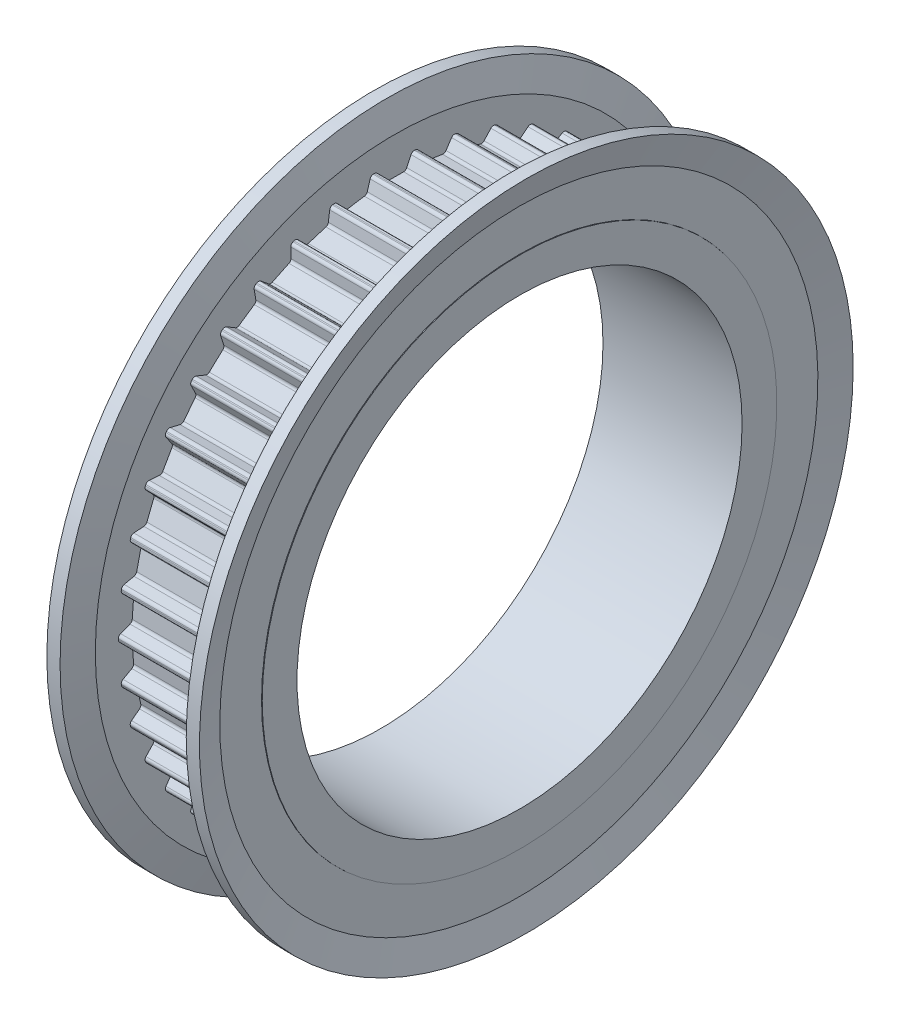
from build123d import *

# Parameters (mm, degrees)
REVOLVE1_START           = 0.05
REVOLVE1_DEPTH           = 9.9
REVOLVE1_START_2         = 9.535898285
REVOLVE1_2_OUTLINE_R     = 23.5
REVOLVE1_2_DEPTH         = 0.414101715
REVOLVE1_3_OUTLINE_R     = 23.5
REVOLVE1_3_DEPTH         = 0.414101515
REVOLVE1_4_OUTLINE_R     = 18.5
REVOLVE1_4_DEPTH         = 0.05
F_6_0_6_DIAMETER_HOLE1_D = 6
FILLET1_R                = 0.25
CUT_EXTRUDE1_DEPTH       = 35.849018135
CUT_EXTRUDE1_DEPTH_BACK  = 35.849018135
SKETCH5_R                = 16


with BuildPart() as part:
    # Revolve1: read off the stored shape, not the designer's step
    # Revolve1 outline → Revolve1 (new body)
    with BuildSketch(Plane.YZ.offset(REVOLVE1_START)):
        with BuildLine():
            ThreePointArc((-8.802769772, -17.791395233), (-8.612592221, -17.884232028), (-8.421435729, -17.975036029))
            Line((-8.421435729, -17.975036029), (-7.654649152, -17.245563817))
            Line((-7.654649152, -17.245563817), (-6.118707467, -17.848376507))
            Line((-6.118707467, -17.848376507), (-6.052780243, -18.904664803))
            ThreePointArc((-6.052780243, -18.904664803), (-5.850890212, -18.968120195), (-5.648335146, -19.029419594))
            Line((-5.648335146, -19.029419594), (-4.998835133, -18.193811374))
            Line((-4.998835133, -18.193811374), (-3.390204078, -18.560970915))
            Line((-3.390204078, -18.560970915), (-3.167581605, -19.595635401))
            ThreePointArc((-3.167581605, -19.595635401), (-2.958488984, -19.628291901), (-2.749060089, -19.65871737))
            Line((-2.749060089, -19.65871737), (-2.231355397, -18.73563925))
            Line((-2.231355397, -18.73563925), (-0.585969131, -18.858943904))
            Line((-0.585969131, -18.858943904), (-0.211624428, -19.848871885))
            ThreePointArc((-0.211624428, -19.848871885), (0, -19.85), (0.211624428, -19.848871885))
            Line((0.211624428, -19.848871885), (0.585969131, -18.858943904))
            Line((0.585969131, -18.858943904), (2.231355397, -18.73563925))
            Line((2.231355397, -18.73563925), (2.749060089, -19.65871737))
            ThreePointArc((2.749060089, -19.65871737), (2.958488984, -19.628291901), (3.167581605, -19.595635401))
            Line((3.167581605, -19.595635401), (3.390204078, -18.560970915))
            Line((3.390204078, -18.560970915), (4.998835133, -18.193811374))
            Line((4.998835133, -18.193811374), (5.648335146, -19.029419594))
            ThreePointArc((5.648335146, -19.029419594), (5.850890212, -18.968120195), (6.052780243, -18.904664803))
            Line((6.052780243, -18.904664803), (6.118707467, -17.848376507))
            Line((6.118707467, -17.848376507), (7.654649152, -17.245563817))
            Line((7.654649152, -17.245563817), (8.421435729, -17.975036029))
            ThreePointArc((8.421435729, -17.975036029), (8.612592221, -17.884232028), (8.802769772, -17.791395233))
            Line((8.802769772, -17.791395233), (8.710529042, -16.737078861))
            Line((8.710529042, -16.737078861), (10.139470958, -15.912078861))
            Line((10.139470958, -15.912078861), (11.006415354, -16.519119863))
            ThreePointArc((11.006415354, -16.519119863), (11.181903152, -16.40083967), (11.356119971, -16.280695293))
            Line((11.356119971, -16.280695293), (11.107771792, -15.251902531))
            Line((11.107771792, -15.251902531), (12.397793738, -14.223144358))
            Line((12.397793738, -14.223144358), (13.345529848, -14.694193856))
            ThreePointArc((13.345529848, -14.694193856), (13.501428845, -14.551079656), (13.655793215, -14.406311522))
            Line((13.655793215, -14.406311522), (13.256885275, -13.426023901))
            Line((13.256885275, -13.426023901), (14.379170293, -12.216488313))
            Line((14.379170293, -12.216488313), (15.386527258, -12.541023839))
            ThreePointArc((15.386527258, -12.541023839), (15.519354927, -12.376272567), (15.650418604, -12.210114558))
            Line((15.650418604, -12.210114558), (15.109861848, -11.300230083))
            Line((15.109861848, -11.300230083), (16.039339944, -9.936936106))
            Line((16.039339944, -9.936936106), (17.083815075, -10.107708073))
            ThreePointArc((17.083815075, -10.107708073), (17.190604265, -9.925), (17.295439503, -9.741163812))
            Line((17.295439503, -9.741163812), (16.625309075, -8.922007798))
            Line((16.625309075, -8.922007798), (17.341217245, -7.435409166))
            Line((17.341217245, -7.435409166), (18.399478692, -7.448602812))
            ThreePointArc((18.399478692, -7.448602812), (18.477843911, -7.252019334), (18.554108863, -7.054611562))
            Line((18.554108863, -7.054611562), (17.76937437, -6.344482602))
            Line((17.76937437, -6.344482602), (18.255720408, -4.767787473))
            Line((18.255720408, -4.767787473), (19.30412836, -4.623108072))
            ThreePointArc((19.30412836, -4.623108072), (19.352319057, -4.417040539), (19.398310091, -4.210470948))
            Line((19.398310091, -4.210470948), (18.516501205, -3.625232149))
            Line((18.516501205, -3.625232149), (18.762420944, -1.993661286))
            Line((18.762420944, -1.993661286), (19.7775557, -1.694340737))
            ThreePointArc((19.7775557, -1.694340737), (19.794495374, -1.483392358), (19.809185127, -1.27227537))
            Line((19.809185127, -1.27227537), (18.85, -0.825))
            Line((18.85, -0.825), (18.85, 0.825))
            Line((18.85, 0.825), (19.809185127, 1.27227537))
            ThreePointArc((19.809185127, 1.27227537), (19.794495374, 1.483392358), (19.7775557, 1.694340737))
            Line((19.7775557, 1.694340737), (18.762420944, 1.993661286))
            Line((18.762420944, 1.993661286), (18.516501205, 3.625232149))
            Line((18.516501205, 3.625232149), (19.398310091, 4.210470948))
            ThreePointArc((19.398310091, 4.210470948), (19.352319057, 4.417040539), (19.30412836, 4.623108072))
            Line((19.30412836, 4.623108072), (18.255720408, 4.767787473))
            Line((18.255720408, 4.767787473), (17.76937437, 6.344482602))
            Line((17.76937437, 6.344482602), (18.554108863, 7.054611562))
            ThreePointArc((18.554108863, 7.054611562), (18.477843911, 7.252019334), (18.399478692, 7.448602812))
            Line((18.399478692, 7.448602812), (17.341217245, 7.435409166))
            Line((17.341217245, 7.435409166), (16.625309075, 8.922007798))
            Line((16.625309075, 8.922007798), (17.295439503, 9.741163812))
            ThreePointArc((17.295439503, 9.741163812), (17.190604265, 9.925), (17.083815075, 10.107708073))
            Line((17.083815075, 10.107708073), (16.039339944, 9.936936106))
            Line((16.039339944, 9.936936106), (15.109861848, 11.300230083))
            Line((15.109861848, 11.300230083), (15.650418604, 12.210114558))
            ThreePointArc((15.650418604, 12.210114558), (15.519354927, 12.376272567), (15.386527258, 12.541023839))
            Line((15.386527258, 12.541023839), (14.379170293, 12.216488313))
            Line((14.379170293, 12.216488313), (13.256885275, 13.426023901))
            Line((13.256885275, 13.426023901), (13.655793215, 14.406311522))
            ThreePointArc((13.655793215, 14.406311522), (13.501428845, 14.551079656), (13.345529848, 14.694193856))
            Line((13.345529848, 14.694193856), (12.397793738, 14.223144358))
            Line((12.397793738, 14.223144358), (11.107771792, 15.251902531))
            Line((11.107771792, 15.251902531), (11.356119971, 16.280695293))
            ThreePointArc((11.356119971, 16.280695293), (11.181903152, 16.40083967), (11.006415354, 16.519119863))
            Line((11.006415354, 16.519119863), (10.139470958, 15.912078861))
            Line((10.139470958, 15.912078861), (8.710529042, 16.737078861))
            Line((8.710529042, 16.737078861), (8.802769772, 17.791395233))
            ThreePointArc((8.802769772, 17.791395233), (8.612592221, 17.884232028), (8.421435729, 17.975036029))
            Line((8.421435729, 17.975036029), (7.654649152, 17.245563817))
            Line((7.654649152, 17.245563817), (6.118707467, 17.848376507))
            Line((6.118707467, 17.848376507), (6.052780243, 18.904664803))
            ThreePointArc((6.052780243, 18.904664803), (5.850890212, 18.968120195), (5.648335146, 19.029419594))
            Line((5.648335146, 19.029419594), (4.998835133, 18.193811374))
            Line((4.998835133, 18.193811374), (3.390204078, 18.560970915))
            Line((3.390204078, 18.560970915), (3.167581605, 19.595635401))
            ThreePointArc((3.167581605, 19.595635401), (2.958488984, 19.628291901), (2.749060089, 19.65871737))
            Line((2.749060089, 19.65871737), (2.231355397, 18.73563925))
            Line((2.231355397, 18.73563925), (0.585969131, 18.858943904))
            Line((0.585969131, 18.858943904), (0.211624428, 19.848871885))
            ThreePointArc((0.211624428, 19.848871885), (0, 19.85), (-0.211624428, 19.848871885))
            Line((-0.211624428, 19.848871885), (-0.585969131, 18.858943904))
            Line((-0.585969131, 18.858943904), (-2.231355397, 18.73563925))
            Line((-2.231355397, 18.73563925), (-2.749060089, 19.65871737))
            ThreePointArc((-2.749060089, 19.65871737), (-2.958488984, 19.628291901), (-3.167581605, 19.595635401))
            Line((-3.167581605, 19.595635401), (-3.390204078, 18.560970915))
            Line((-3.390204078, 18.560970915), (-4.998835133, 18.193811374))
            Line((-4.998835133, 18.193811374), (-5.648335146, 19.029419594))
            ThreePointArc((-5.648335146, 19.029419594), (-5.850890212, 18.968120195), (-6.052780243, 18.904664803))
            Line((-6.052780243, 18.904664803), (-6.118707467, 17.848376507))
            Line((-6.118707467, 17.848376507), (-7.654649152, 17.245563817))
            Line((-7.654649152, 17.245563817), (-8.421435729, 17.975036029))
            ThreePointArc((-8.421435729, 17.975036029), (-8.612592221, 17.884232028), (-8.802769772, 17.791395233))
            Line((-8.802769772, 17.791395233), (-8.710529042, 16.737078861))
            Line((-8.710529042, 16.737078861), (-10.139470958, 15.912078861))
            Line((-10.139470958, 15.912078861), (-11.006415354, 16.519119863))
            ThreePointArc((-11.006415354, 16.519119863), (-11.181903152, 16.40083967), (-11.356119971, 16.280695293))
            Line((-11.356119971, 16.280695293), (-11.107771792, 15.251902531))
            Line((-11.107771792, 15.251902531), (-12.397793738, 14.223144358))
            Line((-12.397793738, 14.223144358), (-13.345529848, 14.694193856))
            ThreePointArc((-13.345529848, 14.694193856), (-13.501428845, 14.551079656), (-13.655793215, 14.406311522))
            Line((-13.655793215, 14.406311522), (-13.256885275, 13.426023901))
            Line((-13.256885275, 13.426023901), (-14.379170293, 12.216488313))
            Line((-14.379170293, 12.216488313), (-15.386527258, 12.541023839))
            ThreePointArc((-15.386527258, 12.541023839), (-15.519354927, 12.376272567), (-15.650418604, 12.210114558))
            Line((-15.650418604, 12.210114558), (-15.109861848, 11.300230083))
            Line((-15.109861848, 11.300230083), (-16.039339944, 9.936936106))
            Line((-16.039339944, 9.936936106), (-17.083815075, 10.107708073))
            ThreePointArc((-17.083815075, 10.107708073), (-17.190604265, 9.925), (-17.295439503, 9.741163812))
            Line((-17.295439503, 9.741163812), (-16.625309075, 8.922007798))
            Line((-16.625309075, 8.922007798), (-17.341217245, 7.435409166))
            Line((-17.341217245, 7.435409166), (-18.399478692, 7.448602812))
            ThreePointArc((-18.399478692, 7.448602812), (-18.477843911, 7.252019334), (-18.554108863, 7.054611562))
            Line((-18.554108863, 7.054611562), (-17.76937437, 6.344482602))
            Line((-17.76937437, 6.344482602), (-18.255720408, 4.767787473))
            Line((-18.255720408, 4.767787473), (-19.30412836, 4.623108072))
            ThreePointArc((-19.30412836, 4.623108072), (-19.352319057, 4.417040539), (-19.398310091, 4.210470948))
            Line((-19.398310091, 4.210470948), (-18.516501205, 3.625232149))
            Line((-18.516501205, 3.625232149), (-18.762420944, 1.993661286))
            Line((-18.762420944, 1.993661286), (-19.7775557, 1.694340737))
            ThreePointArc((-19.7775557, 1.694340737), (-19.794495374, 1.483392358), (-19.809185127, 1.27227537))
            Line((-19.809185127, 1.27227537), (-18.85, 0.825))
            Line((-18.85, 0.825), (-18.85, -0.825))
            Line((-18.85, -0.825), (-19.809185127, -1.27227537))
            ThreePointArc((-19.809185127, -1.27227537), (-19.794495374, -1.483392358), (-19.7775557, -1.694340737))
            Line((-19.7775557, -1.694340737), (-18.762420944, -1.993661286))
            Line((-18.762420944, -1.993661286), (-18.516501205, -3.625232149))
            Line((-18.516501205, -3.625232149), (-19.398310091, -4.210470948))
            ThreePointArc((-19.398310091, -4.210470948), (-19.352319057, -4.417040539), (-19.30412836, -4.623108072))
            Line((-19.30412836, -4.623108072), (-18.255720408, -4.767787473))
            Line((-18.255720408, -4.767787473), (-17.76937437, -6.344482602))
            Line((-17.76937437, -6.344482602), (-18.554108863, -7.054611562))
            ThreePointArc((-18.554108863, -7.054611562), (-18.477843911, -7.252019334), (-18.399478692, -7.448602812))
            Line((-18.399478692, -7.448602812), (-17.341217245, -7.435409166))
            Line((-17.341217245, -7.435409166), (-16.625309075, -8.922007798))
            Line((-16.625309075, -8.922007798), (-17.295439503, -9.741163812))
            ThreePointArc((-17.295439503, -9.741163812), (-17.190604265, -9.925), (-17.083815075, -10.107708073))
            Line((-17.083815075, -10.107708073), (-16.039339944, -9.936936106))
            Line((-16.039339944, -9.936936106), (-15.109861848, -11.300230083))
            Line((-15.109861848, -11.300230083), (-15.650418604, -12.210114558))
            ThreePointArc((-15.650418604, -12.210114558), (-15.519354927, -12.376272567), (-15.386527258, -12.541023839))
            Line((-15.386527258, -12.541023839), (-14.379170293, -12.216488313))
            Line((-14.379170293, -12.216488313), (-13.256885275, -13.426023901))
            Line((-13.256885275, -13.426023901), (-13.655793215, -14.406311522))
            ThreePointArc((-13.655793215, -14.406311522), (-13.501428845, -14.551079656), (-13.345529848, -14.694193856))
            Line((-13.345529848, -14.694193856), (-12.397793738, -14.223144358))
            Line((-12.397793738, -14.223144358), (-11.107771792, -15.251902531))
            Line((-11.107771792, -15.251902531), (-11.356119971, -16.280695293))
            ThreePointArc((-11.356119971, -16.280695293), (-11.181903152, -16.40083967), (-11.006415354, -16.519119863))
            Line((-11.006415354, -16.519119863), (-10.139470958, -15.912078861))
            Line((-10.139470958, -15.912078861), (-8.710529042, -16.737078861))
            Line((-8.710529042, -16.737078861), (-8.802769772, -17.791395233))
        make_face()
    extrude(amount=REVOLVE1_DEPTH)

    # Revolve1 2 outline → Revolve1 2 (add)
    with BuildSketch(Plane.YZ.offset(REVOLVE1_START_2)):
        Circle(REVOLVE1_2_OUTLINE_R)
        with BuildLine():
            Line((-7.654649152, -17.245563817), (-8.421435729, -17.975036029))
            ThreePointArc((-8.421435729, -17.975036029), (-8.612592221, -17.884232028), (-8.802769772, -17.791395233))
            Line((-8.802769772, -17.791395233), (-8.710529042, -16.737078861))
            Line((-8.710529042, -16.737078861), (-10.139470958, -15.912078861))
            Line((-10.139470958, -15.912078861), (-11.006415354, -16.519119863))
            ThreePointArc((-11.006415354, -16.519119863), (-11.181903152, -16.40083967), (-11.356119971, -16.280695293))
            Line((-11.356119971, -16.280695293), (-11.107771792, -15.251902531))
            Line((-11.107771792, -15.251902531), (-12.397793738, -14.223144358))
            Line((-12.397793738, -14.223144358), (-13.345529848, -14.694193856))
            ThreePointArc((-13.345529848, -14.694193856), (-13.501428845, -14.551079656), (-13.655793215, -14.406311522))
            Line((-13.655793215, -14.406311522), (-13.256885275, -13.426023901))
            Line((-13.256885275, -13.426023901), (-14.379170293, -12.216488313))
            Line((-14.379170293, -12.216488313), (-15.386527258, -12.541023839))
            ThreePointArc((-15.386527258, -12.541023839), (-15.519354927, -12.376272567), (-15.650418604, -12.210114558))
            Line((-15.650418604, -12.210114558), (-15.109861848, -11.300230083))
            Line((-15.109861848, -11.300230083), (-16.039339944, -9.936936106))
            Line((-16.039339944, -9.936936106), (-17.083815075, -10.107708073))
            ThreePointArc((-17.083815075, -10.107708073), (-17.190604265, -9.925), (-17.295439503, -9.741163812))
            Line((-17.295439503, -9.741163812), (-16.625309075, -8.922007798))
            Line((-16.625309075, -8.922007798), (-17.341217245, -7.435409166))
            Line((-17.341217245, -7.435409166), (-18.399478692, -7.448602812))
            ThreePointArc((-18.399478692, -7.448602812), (-18.477843911, -7.252019334), (-18.554108863, -7.054611562))
            Line((-18.554108863, -7.054611562), (-17.76937437, -6.344482602))
            Line((-17.76937437, -6.344482602), (-18.255720408, -4.767787473))
            Line((-18.255720408, -4.767787473), (-19.30412836, -4.623108072))
            ThreePointArc((-19.30412836, -4.623108072), (-19.352319057, -4.417040539), (-19.398310091, -4.210470948))
            Line((-19.398310091, -4.210470948), (-18.516501205, -3.625232149))
            Line((-18.516501205, -3.625232149), (-18.762420944, -1.993661286))
            Line((-18.762420944, -1.993661286), (-19.7775557, -1.694340737))
            ThreePointArc((-19.7775557, -1.694340737), (-19.794495374, -1.483392358), (-19.809185127, -1.27227537))
            Line((-19.809185127, -1.27227537), (-18.85, -0.825))
            Line((-18.85, -0.825), (-18.85, 0.825))
            Line((-18.85, 0.825), (-19.809185127, 1.27227537))
            ThreePointArc((-19.809185127, 1.27227537), (-19.794495374, 1.483392358), (-19.7775557, 1.694340737))
            Line((-19.7775557, 1.694340737), (-18.762420944, 1.993661286))
            Line((-18.762420944, 1.993661286), (-18.516501205, 3.625232149))
            Line((-18.516501205, 3.625232149), (-19.398310091, 4.210470948))
            ThreePointArc((-19.398310091, 4.210470948), (-19.352319057, 4.417040539), (-19.30412836, 4.623108072))
            Line((-19.30412836, 4.623108072), (-18.255720408, 4.767787473))
            Line((-18.255720408, 4.767787473), (-17.76937437, 6.344482602))
            Line((-17.76937437, 6.344482602), (-18.554108863, 7.054611562))
            ThreePointArc((-18.554108863, 7.054611562), (-18.477843911, 7.252019334), (-18.399478692, 7.448602812))
            Line((-18.399478692, 7.448602812), (-17.341217245, 7.435409166))
            Line((-17.341217245, 7.435409166), (-16.625309075, 8.922007798))
            Line((-16.625309075, 8.922007798), (-17.295439503, 9.741163812))
            ThreePointArc((-17.295439503, 9.741163812), (-17.190604265, 9.925), (-17.083815075, 10.107708073))
            Line((-17.083815075, 10.107708073), (-16.039339944, 9.936936106))
            Line((-16.039339944, 9.936936106), (-15.109861848, 11.300230083))
            Line((-15.109861848, 11.300230083), (-15.650418604, 12.210114558))
            ThreePointArc((-15.650418604, 12.210114558), (-15.519354927, 12.376272567), (-15.386527258, 12.541023839))
            Line((-15.386527258, 12.541023839), (-14.379170293, 12.216488313))
            Line((-14.379170293, 12.216488313), (-13.256885275, 13.426023901))
            Line((-13.256885275, 13.426023901), (-13.655793215, 14.406311522))
            ThreePointArc((-13.655793215, 14.406311522), (-13.501428845, 14.551079656), (-13.345529848, 14.694193856))
            Line((-13.345529848, 14.694193856), (-12.397793738, 14.223144358))
            Line((-12.397793738, 14.223144358), (-11.107771792, 15.251902531))
            Line((-11.107771792, 15.251902531), (-11.356119971, 16.280695293))
            ThreePointArc((-11.356119971, 16.280695293), (-11.181903152, 16.40083967), (-11.006415354, 16.519119863))
            Line((-11.006415354, 16.519119863), (-10.139470958, 15.912078861))
            Line((-10.139470958, 15.912078861), (-8.710529042, 16.737078861))
            Line((-8.710529042, 16.737078861), (-8.802769772, 17.791395233))
            ThreePointArc((-8.802769772, 17.791395233), (-8.612592221, 17.884232028), (-8.421435729, 17.975036029))
            Line((-8.421435729, 17.975036029), (-7.654649152, 17.245563817))
            Line((-7.654649152, 17.245563817), (-6.118707467, 17.848376507))
            Line((-6.118707467, 17.848376507), (-6.052780243, 18.904664803))
            ThreePointArc((-6.052780243, 18.904664803), (-5.850890212, 18.968120195), (-5.648335146, 19.029419594))
            Line((-5.648335146, 19.029419594), (-4.998835133, 18.193811374))
            Line((-4.998835133, 18.193811374), (-3.390204078, 18.560970915))
            Line((-3.390204078, 18.560970915), (-3.167581605, 19.595635401))
            ThreePointArc((-3.167581605, 19.595635401), (-2.958488984, 19.628291901), (-2.749060089, 19.65871737))
            Line((-2.749060089, 19.65871737), (-2.231355397, 18.73563925))
            Line((-2.231355397, 18.73563925), (-0.585969131, 18.858943904))
            Line((-0.585969131, 18.858943904), (-0.211624428, 19.848871885))
            ThreePointArc((-0.211624428, 19.848871885), (0, 19.85), (0.211624428, 19.848871885))
            Line((0.211624428, 19.848871885), (0.585969131, 18.858943904))
            Line((0.585969131, 18.858943904), (2.231355397, 18.73563925))
            Line((2.231355397, 18.73563925), (2.749060089, 19.65871737))
            ThreePointArc((2.749060089, 19.65871737), (2.958488984, 19.628291901), (3.167581605, 19.595635401))
            Line((3.167581605, 19.595635401), (3.390204078, 18.560970915))
            Line((3.390204078, 18.560970915), (4.998835133, 18.193811374))
            Line((4.998835133, 18.193811374), (5.648335146, 19.029419594))
            ThreePointArc((5.648335146, 19.029419594), (5.850890212, 18.968120195), (6.052780243, 18.904664803))
            Line((6.052780243, 18.904664803), (6.118707467, 17.848376507))
            Line((6.118707467, 17.848376507), (7.654649152, 17.245563817))
            Line((7.654649152, 17.245563817), (8.421435729, 17.975036029))
            ThreePointArc((8.421435729, 17.975036029), (8.612592221, 17.884232028), (8.802769772, 17.791395233))
            Line((8.802769772, 17.791395233), (8.710529042, 16.737078861))
            Line((8.710529042, 16.737078861), (10.139470958, 15.912078861))
            Line((10.139470958, 15.912078861), (11.006415354, 16.519119863))
            ThreePointArc((11.006415354, 16.519119863), (11.181903152, 16.40083967), (11.356119971, 16.280695293))
            Line((11.356119971, 16.280695293), (11.107771792, 15.251902531))
            Line((11.107771792, 15.251902531), (12.397793738, 14.223144358))
            Line((12.397793738, 14.223144358), (13.345529848, 14.694193856))
            ThreePointArc((13.345529848, 14.694193856), (13.501428845, 14.551079656), (13.655793215, 14.406311522))
            Line((13.655793215, 14.406311522), (13.256885275, 13.426023901))
            Line((13.256885275, 13.426023901), (14.379170293, 12.216488313))
            Line((14.379170293, 12.216488313), (15.386527258, 12.541023839))
            ThreePointArc((15.386527258, 12.541023839), (15.519354927, 12.376272567), (15.650418604, 12.210114558))
            Line((15.650418604, 12.210114558), (15.109861848, 11.300230083))
            Line((15.109861848, 11.300230083), (16.039339944, 9.936936106))
            Line((16.039339944, 9.936936106), (17.083815075, 10.107708073))
            ThreePointArc((17.083815075, 10.107708073), (17.190604265, 9.925), (17.295439503, 9.741163812))
            Line((17.295439503, 9.741163812), (16.625309075, 8.922007798))
            Line((16.625309075, 8.922007798), (17.341217245, 7.435409166))
            Line((17.341217245, 7.435409166), (18.399478692, 7.448602812))
            ThreePointArc((18.399478692, 7.448602812), (18.477843911, 7.252019334), (18.554108863, 7.054611562))
            Line((18.554108863, 7.054611562), (17.76937437, 6.344482602))
            Line((17.76937437, 6.344482602), (18.255720408, 4.767787473))
            Line((18.255720408, 4.767787473), (19.30412836, 4.623108072))
            ThreePointArc((19.30412836, 4.623108072), (19.352319057, 4.417040539), (19.398310091, 4.210470948))
            Line((19.398310091, 4.210470948), (18.516501205, 3.625232149))
            Line((18.516501205, 3.625232149), (18.762420944, 1.993661286))
            Line((18.762420944, 1.993661286), (19.7775557, 1.694340737))
            ThreePointArc((19.7775557, 1.694340737), (19.794495374, 1.483392358), (19.809185127, 1.27227537))
            Line((19.809185127, 1.27227537), (18.85, 0.825))
            Line((18.85, 0.825), (18.85, -0.825))
            Line((18.85, -0.825), (19.809185127, -1.27227537))
            ThreePointArc((19.809185127, -1.27227537), (19.794495374, -1.483392358), (19.7775557, -1.694340737))
            Line((19.7775557, -1.694340737), (18.762420944, -1.993661286))
            Line((18.762420944, -1.993661286), (18.516501205, -3.625232149))
            Line((18.516501205, -3.625232149), (19.398310091, -4.210470948))
            ThreePointArc((19.398310091, -4.210470948), (19.352319057, -4.417040539), (19.30412836, -4.623108072))
            Line((19.30412836, -4.623108072), (18.255720408, -4.767787473))
            Line((18.255720408, -4.767787473), (17.76937437, -6.344482602))
            Line((17.76937437, -6.344482602), (18.554108863, -7.054611562))
            ThreePointArc((18.554108863, -7.054611562), (18.477843911, -7.252019334), (18.399478692, -7.448602812))
            Line((18.399478692, -7.448602812), (17.341217245, -7.435409166))
            Line((17.341217245, -7.435409166), (16.625309075, -8.922007798))
            Line((16.625309075, -8.922007798), (17.295439503, -9.741163812))
            ThreePointArc((17.295439503, -9.741163812), (17.190604265, -9.925), (17.083815075, -10.107708073))
            Line((17.083815075, -10.107708073), (16.039339944, -9.936936106))
            Line((16.039339944, -9.936936106), (15.109861848, -11.300230083))
            Line((15.109861848, -11.300230083), (15.650418604, -12.210114558))
            ThreePointArc((15.650418604, -12.210114558), (15.519354927, -12.376272567), (15.386527258, -12.541023839))
            Line((15.386527258, -12.541023839), (14.379170293, -12.216488313))
            Line((14.379170293, -12.216488313), (13.256885275, -13.426023901))
            Line((13.256885275, -13.426023901), (13.655793215, -14.406311522))
            ThreePointArc((13.655793215, -14.406311522), (13.501428845, -14.551079656), (13.345529848, -14.694193856))
            Line((13.345529848, -14.694193856), (12.397793738, -14.223144358))
            Line((12.397793738, -14.223144358), (11.107771792, -15.251902531))
            Line((11.107771792, -15.251902531), (11.356119971, -16.280695293))
            ThreePointArc((11.356119971, -16.280695293), (11.181903152, -16.40083967), (11.006415354, -16.519119863))
            Line((11.006415354, -16.519119863), (10.139470958, -15.912078861))
            Line((10.139470958, -15.912078861), (8.710529042, -16.737078861))
            Line((8.710529042, -16.737078861), (8.802769772, -17.791395233))
            ThreePointArc((8.802769772, -17.791395233), (8.612592221, -17.884232028), (8.421435729, -17.975036029))
            Line((8.421435729, -17.975036029), (7.654649152, -17.245563817))
            Line((7.654649152, -17.245563817), (6.118707467, -17.848376507))
            Line((6.118707467, -17.848376507), (6.052780243, -18.904664803))
            ThreePointArc((6.052780243, -18.904664803), (5.850890212, -18.968120195), (5.648335146, -19.029419594))
            Line((5.648335146, -19.029419594), (4.998835133, -18.193811374))
            Line((4.998835133, -18.193811374), (3.390204078, -18.560970915))
            Line((3.390204078, -18.560970915), (3.167581605, -19.595635401))
            ThreePointArc((3.167581605, -19.595635401), (2.958488984, -19.628291901), (2.749060089, -19.65871737))
            Line((2.749060089, -19.65871737), (2.231355397, -18.73563925))
            Line((2.231355397, -18.73563925), (0.585969131, -18.858943904))
            Line((0.585969131, -18.858943904), (0.211624428, -19.848871885))
            ThreePointArc((0.211624428, -19.848871885), (0, -19.85), (-0.211624428, -19.848871885))
            Line((-0.211624428, -19.848871885), (-0.585969131, -18.858943904))
            Line((-0.585969131, -18.858943904), (-2.231355397, -18.73563925))
            Line((-2.231355397, -18.73563925), (-2.749060089, -19.65871737))
            ThreePointArc((-2.749060089, -19.65871737), (-2.958488984, -19.628291901), (-3.167581605, -19.595635401))
            Line((-3.167581605, -19.595635401), (-3.390204078, -18.560970915))
            Line((-3.390204078, -18.560970915), (-4.998835133, -18.193811374))
            Line((-4.998835133, -18.193811374), (-5.648335146, -19.029419594))
            ThreePointArc((-5.648335146, -19.029419594), (-5.850890212, -18.968120195), (-6.052780243, -18.904664803))
            Line((-6.052780243, -18.904664803), (-6.118707467, -17.848376507))
            Line((-6.118707467, -17.848376507), (-7.654649152, -17.245563817))
        make_face(mode=Mode.SUBTRACT)
    extrude(amount=REVOLVE1_2_DEPTH)

    # Revolve1 3 outline → Revolve1 3 (add)
    with BuildSketch(Plane.YZ.offset(REVOLVE1_START)):
        Circle(REVOLVE1_3_OUTLINE_R)
        with BuildLine():
            Line((-7.654649152, -17.245563817), (-8.421435729, -17.975036029))
            ThreePointArc((-8.421435729, -17.975036029), (-8.612592221, -17.884232028), (-8.802769772, -17.791395233))
            Line((-8.802769772, -17.791395233), (-8.710529042, -16.737078861))
            Line((-8.710529042, -16.737078861), (-10.139470958, -15.912078861))
            Line((-10.139470958, -15.912078861), (-11.006415354, -16.519119863))
            ThreePointArc((-11.006415354, -16.519119863), (-11.181903152, -16.40083967), (-11.356119971, -16.280695293))
            Line((-11.356119971, -16.280695293), (-11.107771792, -15.251902531))
            Line((-11.107771792, -15.251902531), (-12.397793738, -14.223144358))
            Line((-12.397793738, -14.223144358), (-13.345529848, -14.694193856))
            ThreePointArc((-13.345529848, -14.694193856), (-13.501428845, -14.551079656), (-13.655793215, -14.406311522))
            Line((-13.655793215, -14.406311522), (-13.256885275, -13.426023901))
            Line((-13.256885275, -13.426023901), (-14.379170293, -12.216488313))
            Line((-14.379170293, -12.216488313), (-15.386527258, -12.541023839))
            ThreePointArc((-15.386527258, -12.541023839), (-15.519354927, -12.376272567), (-15.650418604, -12.210114558))
            Line((-15.650418604, -12.210114558), (-15.109861848, -11.300230083))
            Line((-15.109861848, -11.300230083), (-16.039339944, -9.936936106))
            Line((-16.039339944, -9.936936106), (-17.083815075, -10.107708073))
            ThreePointArc((-17.083815075, -10.107708073), (-17.190604265, -9.925), (-17.295439503, -9.741163812))
            Line((-17.295439503, -9.741163812), (-16.625309075, -8.922007798))
            Line((-16.625309075, -8.922007798), (-17.341217245, -7.435409166))
            Line((-17.341217245, -7.435409166), (-18.399478692, -7.448602812))
            ThreePointArc((-18.399478692, -7.448602812), (-18.477843911, -7.252019334), (-18.554108863, -7.054611562))
            Line((-18.554108863, -7.054611562), (-17.76937437, -6.344482602))
            Line((-17.76937437, -6.344482602), (-18.255720408, -4.767787473))
            Line((-18.255720408, -4.767787473), (-19.30412836, -4.623108072))
            ThreePointArc((-19.30412836, -4.623108072), (-19.352319057, -4.417040539), (-19.398310091, -4.210470948))
            Line((-19.398310091, -4.210470948), (-18.516501205, -3.625232149))
            Line((-18.516501205, -3.625232149), (-18.762420944, -1.993661286))
            Line((-18.762420944, -1.993661286), (-19.7775557, -1.694340737))
            ThreePointArc((-19.7775557, -1.694340737), (-19.794495374, -1.483392358), (-19.809185127, -1.27227537))
            Line((-19.809185127, -1.27227537), (-18.85, -0.825))
            Line((-18.85, -0.825), (-18.85, 0.825))
            Line((-18.85, 0.825), (-19.809185127, 1.27227537))
            ThreePointArc((-19.809185127, 1.27227537), (-19.794495374, 1.483392358), (-19.7775557, 1.694340737))
            Line((-19.7775557, 1.694340737), (-18.762420944, 1.993661286))
            Line((-18.762420944, 1.993661286), (-18.516501205, 3.625232149))
            Line((-18.516501205, 3.625232149), (-19.398310091, 4.210470948))
            ThreePointArc((-19.398310091, 4.210470948), (-19.352319057, 4.417040539), (-19.30412836, 4.623108072))
            Line((-19.30412836, 4.623108072), (-18.255720408, 4.767787473))
            Line((-18.255720408, 4.767787473), (-17.76937437, 6.344482602))
            Line((-17.76937437, 6.344482602), (-18.554108863, 7.054611562))
            ThreePointArc((-18.554108863, 7.054611562), (-18.477843911, 7.252019334), (-18.399478692, 7.448602812))
            Line((-18.399478692, 7.448602812), (-17.341217245, 7.435409166))
            Line((-17.341217245, 7.435409166), (-16.625309075, 8.922007798))
            Line((-16.625309075, 8.922007798), (-17.295439503, 9.741163812))
            ThreePointArc((-17.295439503, 9.741163812), (-17.190604265, 9.925), (-17.083815075, 10.107708073))
            Line((-17.083815075, 10.107708073), (-16.039339944, 9.936936106))
            Line((-16.039339944, 9.936936106), (-15.109861848, 11.300230083))
            Line((-15.109861848, 11.300230083), (-15.650418604, 12.210114558))
            ThreePointArc((-15.650418604, 12.210114558), (-15.519354927, 12.376272567), (-15.386527258, 12.541023839))
            Line((-15.386527258, 12.541023839), (-14.379170293, 12.216488313))
            Line((-14.379170293, 12.216488313), (-13.256885275, 13.426023901))
            Line((-13.256885275, 13.426023901), (-13.655793215, 14.406311522))
            ThreePointArc((-13.655793215, 14.406311522), (-13.501428845, 14.551079656), (-13.345529848, 14.694193856))
            Line((-13.345529848, 14.694193856), (-12.397793738, 14.223144358))
            Line((-12.397793738, 14.223144358), (-11.107771792, 15.251902531))
            Line((-11.107771792, 15.251902531), (-11.356119971, 16.280695293))
            ThreePointArc((-11.356119971, 16.280695293), (-11.181903152, 16.40083967), (-11.006415354, 16.519119863))
            Line((-11.006415354, 16.519119863), (-10.139470958, 15.912078861))
            Line((-10.139470958, 15.912078861), (-8.710529042, 16.737078861))
            Line((-8.710529042, 16.737078861), (-8.802769772, 17.791395233))
            ThreePointArc((-8.802769772, 17.791395233), (-8.612592221, 17.884232028), (-8.421435729, 17.975036029))
            Line((-8.421435729, 17.975036029), (-7.654649152, 17.245563817))
            Line((-7.654649152, 17.245563817), (-6.118707467, 17.848376507))
            Line((-6.118707467, 17.848376507), (-6.052780243, 18.904664803))
            ThreePointArc((-6.052780243, 18.904664803), (-5.850890212, 18.968120195), (-5.648335146, 19.029419594))
            Line((-5.648335146, 19.029419594), (-4.998835133, 18.193811374))
            Line((-4.998835133, 18.193811374), (-3.390204078, 18.560970915))
            Line((-3.390204078, 18.560970915), (-3.167581605, 19.595635401))
            ThreePointArc((-3.167581605, 19.595635401), (-2.958488984, 19.628291901), (-2.749060089, 19.65871737))
            Line((-2.749060089, 19.65871737), (-2.231355397, 18.73563925))
            Line((-2.231355397, 18.73563925), (-0.585969131, 18.858943904))
            Line((-0.585969131, 18.858943904), (-0.211624428, 19.848871885))
            ThreePointArc((-0.211624428, 19.848871885), (0, 19.85), (0.211624428, 19.848871885))
            Line((0.211624428, 19.848871885), (0.585969131, 18.858943904))
            Line((0.585969131, 18.858943904), (2.231355397, 18.73563925))
            Line((2.231355397, 18.73563925), (2.749060089, 19.65871737))
            ThreePointArc((2.749060089, 19.65871737), (2.958488984, 19.628291901), (3.167581605, 19.595635401))
            Line((3.167581605, 19.595635401), (3.390204078, 18.560970915))
            Line((3.390204078, 18.560970915), (4.998835133, 18.193811374))
            Line((4.998835133, 18.193811374), (5.648335146, 19.029419594))
            ThreePointArc((5.648335146, 19.029419594), (5.850890212, 18.968120195), (6.052780243, 18.904664803))
            Line((6.052780243, 18.904664803), (6.118707467, 17.848376507))
            Line((6.118707467, 17.848376507), (7.654649152, 17.245563817))
            Line((7.654649152, 17.245563817), (8.421435729, 17.975036029))
            ThreePointArc((8.421435729, 17.975036029), (8.612592221, 17.884232028), (8.802769772, 17.791395233))
            Line((8.802769772, 17.791395233), (8.710529042, 16.737078861))
            Line((8.710529042, 16.737078861), (10.139470958, 15.912078861))
            Line((10.139470958, 15.912078861), (11.006415354, 16.519119863))
            ThreePointArc((11.006415354, 16.519119863), (11.181903152, 16.40083967), (11.356119971, 16.280695293))
            Line((11.356119971, 16.280695293), (11.107771792, 15.251902531))
            Line((11.107771792, 15.251902531), (12.397793738, 14.223144358))
            Line((12.397793738, 14.223144358), (13.345529848, 14.694193856))
            ThreePointArc((13.345529848, 14.694193856), (13.501428845, 14.551079656), (13.655793215, 14.406311522))
            Line((13.655793215, 14.406311522), (13.256885275, 13.426023901))
            Line((13.256885275, 13.426023901), (14.379170293, 12.216488313))
            Line((14.379170293, 12.216488313), (15.386527258, 12.541023839))
            ThreePointArc((15.386527258, 12.541023839), (15.519354927, 12.376272567), (15.650418604, 12.210114558))
            Line((15.650418604, 12.210114558), (15.109861848, 11.300230083))
            Line((15.109861848, 11.300230083), (16.039339944, 9.936936106))
            Line((16.039339944, 9.936936106), (17.083815075, 10.107708073))
            ThreePointArc((17.083815075, 10.107708073), (17.190604265, 9.925), (17.295439503, 9.741163812))
            Line((17.295439503, 9.741163812), (16.625309075, 8.922007798))
            Line((16.625309075, 8.922007798), (17.341217245, 7.435409166))
            Line((17.341217245, 7.435409166), (18.399478692, 7.448602812))
            ThreePointArc((18.399478692, 7.448602812), (18.477843911, 7.252019334), (18.554108863, 7.054611562))
            Line((18.554108863, 7.054611562), (17.76937437, 6.344482602))
            Line((17.76937437, 6.344482602), (18.255720408, 4.767787473))
            Line((18.255720408, 4.767787473), (19.30412836, 4.623108072))
            ThreePointArc((19.30412836, 4.623108072), (19.352319057, 4.417040539), (19.398310091, 4.210470948))
            Line((19.398310091, 4.210470948), (18.516501205, 3.625232149))
            Line((18.516501205, 3.625232149), (18.762420944, 1.993661286))
            Line((18.762420944, 1.993661286), (19.7775557, 1.694340737))
            ThreePointArc((19.7775557, 1.694340737), (19.794495374, 1.483392358), (19.809185127, 1.27227537))
            Line((19.809185127, 1.27227537), (18.85, 0.825))
            Line((18.85, 0.825), (18.85, -0.825))
            Line((18.85, -0.825), (19.809185127, -1.27227537))
            ThreePointArc((19.809185127, -1.27227537), (19.794495374, -1.483392358), (19.7775557, -1.694340737))
            Line((19.7775557, -1.694340737), (18.762420944, -1.993661286))
            Line((18.762420944, -1.993661286), (18.516501205, -3.625232149))
            Line((18.516501205, -3.625232149), (19.398310091, -4.210470948))
            ThreePointArc((19.398310091, -4.210470948), (19.352319057, -4.417040539), (19.30412836, -4.623108072))
            Line((19.30412836, -4.623108072), (18.255720408, -4.767787473))
            Line((18.255720408, -4.767787473), (17.76937437, -6.344482602))
            Line((17.76937437, -6.344482602), (18.554108863, -7.054611562))
            ThreePointArc((18.554108863, -7.054611562), (18.477843911, -7.252019334), (18.399478692, -7.448602812))
            Line((18.399478692, -7.448602812), (17.341217245, -7.435409166))
            Line((17.341217245, -7.435409166), (16.625309075, -8.922007798))
            Line((16.625309075, -8.922007798), (17.295439503, -9.741163812))
            ThreePointArc((17.295439503, -9.741163812), (17.190604265, -9.925), (17.083815075, -10.107708073))
            Line((17.083815075, -10.107708073), (16.039339944, -9.936936106))
            Line((16.039339944, -9.936936106), (15.109861848, -11.300230083))
            Line((15.109861848, -11.300230083), (15.650418604, -12.210114558))
            ThreePointArc((15.650418604, -12.210114558), (15.519354927, -12.376272567), (15.386527258, -12.541023839))
            Line((15.386527258, -12.541023839), (14.379170293, -12.216488313))
            Line((14.379170293, -12.216488313), (13.256885275, -13.426023901))
            Line((13.256885275, -13.426023901), (13.655793215, -14.406311522))
            ThreePointArc((13.655793215, -14.406311522), (13.501428845, -14.551079656), (13.345529848, -14.694193856))
            Line((13.345529848, -14.694193856), (12.397793738, -14.223144358))
            Line((12.397793738, -14.223144358), (11.107771792, -15.251902531))
            Line((11.107771792, -15.251902531), (11.356119971, -16.280695293))
            ThreePointArc((11.356119971, -16.280695293), (11.181903152, -16.40083967), (11.006415354, -16.519119863))
            Line((11.006415354, -16.519119863), (10.139470958, -15.912078861))
            Line((10.139470958, -15.912078861), (8.710529042, -16.737078861))
            Line((8.710529042, -16.737078861), (8.802769772, -17.791395233))
            ThreePointArc((8.802769772, -17.791395233), (8.612592221, -17.884232028), (8.421435729, -17.975036029))
            Line((8.421435729, -17.975036029), (7.654649152, -17.245563817))
            Line((7.654649152, -17.245563817), (6.118707467, -17.848376507))
            Line((6.118707467, -17.848376507), (6.052780243, -18.904664803))
            ThreePointArc((6.052780243, -18.904664803), (5.850890212, -18.968120195), (5.648335146, -19.029419594))
            Line((5.648335146, -19.029419594), (4.998835133, -18.193811374))
            Line((4.998835133, -18.193811374), (3.390204078, -18.560970915))
            Line((3.390204078, -18.560970915), (3.167581605, -19.595635401))
            ThreePointArc((3.167581605, -19.595635401), (2.958488984, -19.628291901), (2.749060089, -19.65871737))
            Line((2.749060089, -19.65871737), (2.231355397, -18.73563925))
            Line((2.231355397, -18.73563925), (0.585969131, -18.858943904))
            Line((0.585969131, -18.858943904), (0.211624428, -19.848871885))
            ThreePointArc((0.211624428, -19.848871885), (0, -19.85), (-0.211624428, -19.848871885))
            Line((-0.211624428, -19.848871885), (-0.585969131, -18.858943904))
            Line((-0.585969131, -18.858943904), (-2.231355397, -18.73563925))
            Line((-2.231355397, -18.73563925), (-2.749060089, -19.65871737))
            ThreePointArc((-2.749060089, -19.65871737), (-2.958488984, -19.628291901), (-3.167581605, -19.595635401))
            Line((-3.167581605, -19.595635401), (-3.390204078, -18.560970915))
            Line((-3.390204078, -18.560970915), (-4.998835133, -18.193811374))
            Line((-4.998835133, -18.193811374), (-5.648335146, -19.029419594))
            ThreePointArc((-5.648335146, -19.029419594), (-5.850890212, -18.968120195), (-6.052780243, -18.904664803))
            Line((-6.052780243, -18.904664803), (-6.118707467, -17.848376507))
            Line((-6.118707467, -17.848376507), (-7.654649152, -17.245563817))
        make_face(mode=Mode.SUBTRACT)
    extrude(amount=REVOLVE1_3_DEPTH)

    # Revolve1 4 outline → Revolve1 4 (add)
    with BuildSketch(Plane.YZ):
        Circle(REVOLVE1_4_OUTLINE_R)
    extrude(amount=REVOLVE1_4_DEPTH)

    # Revolve1 5 outline → Revolve1 5 (revolve)
    with BuildSketch(Plane.YX):
        Polygon((23.5, 9.535898345), (18.85, 9.535898285), (18.85, 9), (21.5, 9), align=None)
        Polygon((18.85, 0.464101515), (23.5, 0.464101575), (21.5, 1), (18.85, 1), align=None)
        Polygon((21.5, 9.95), (23.5, 9.95), (23.5, 10.485898385), align=None)
        Polygon((23.5, -0.485898385), (23.5, 0.05), (21.5, 0.05), align=None)
    revolve(axis=Axis((0, 0, 0), (1, 0, 0)))

    # Sketch2 → Revolve2 (revolve)
    with BuildSketch(Plane(origin=(0, 0, 0), x_dir=(-1, 0, 0), z_dir=(0, 0, -1)), mode=Mode.PRIVATE) as revolve2_sk:
        Polygon((-16, 13), (-16, 0), (-9.95, 0), (-9.95, 18.5), (-10, 18.5), (-10, 13), align=None)
    revolve(revolve2_sk.sketch.rotate(Axis((16, 0, 0), (-1, 0, 0)), 270), axis=Axis((16, 0, 0), (-1, 0, 0)))

    # Ø6.0 (6) Diameter Hole1 (through all)
    with Locations(Plane(origin=(16, 0, 0), x_dir=(0, 0, -1), z_dir=(1, 0, 0))):
        with Locations((0, 0)):
            Hole(F_6_0_6_DIAMETER_HOLE1_D / 2)

    # Fillet1
    fillet1_edges = [part.edges().sort_by_distance(p)[0] for p in [
        (5, -0.211624428, -19.848871885),
        (5, 19.30412836, -4.623108072),
        (5, -14.379170293, -12.216488313),
        (5, 18.516501205, -3.625232149),
        (5, 0.211624428, -19.848871885),
        (5, 19.7775557, -1.694340737),
        (5, -15.386527258, -12.541023839),
        (5, 18.85, -0.825),
        (5, 0.585969131, -18.858943904),
        (5, 19.809185127, 1.27227537),
        (5, -15.650418604, -12.210114558),
        (5, 18.762420944, 1.993661286),
        (5, 2.231355397, -18.73563925),
        (5, 19.398310091, 4.210470948),
        (5, -15.109861848, -11.300230083),
        (5, 18.255720408, 4.767787473),
        (5, 2.749060089, -19.65871737),
        (5, 18.554108863, 7.054611562),
        (5, -16.039339944, -9.936936106),
        (5, 17.341217245, 7.435409166),
        (5, 3.167581605, -19.595635401),
        (5, 17.295439503, 9.741163812),
        (5, -17.083815075, -10.107708073),
        (5, 16.039339944, 9.936936106),
        (5, 3.390204078, -18.560970915),
        (5, 15.650418604, 12.210114558),
        (5, -17.295439503, -9.741163812),
        (5, 14.379170293, 12.216488313),
        (5, 4.998835133, -18.193811374),
        (5, 13.655793215, 14.406311522),
        (5, -16.625309075, -8.922007798),
        (5, 12.397793738, 14.223144358),
        (5, 5.648335146, -19.029419594),
        (5, 11.356119971, 16.280695293),
        (5, -17.341217245, -7.435409166),
        (5, 10.139470958, 15.912078861),
        (5, 6.052780243, -18.904664803),
        (5, 8.802769772, 17.791395233),
        (5, -18.399478692, -7.448602812),
        (5, -17.341217245, 7.435409166),
        (5, 6.118707467, -17.848376507),
        (5, -16.625309075, 8.922007798),
        (5, -18.554108863, -7.054611562),
        (5, -17.295439503, 9.741163812),
        (5, 7.654649152, -17.245563817),
        (5, -17.083815075, 10.107708073),
        (5, -17.76937437, -6.344482602),
        (5, -16.039339944, 9.936936106),
        (5, 8.421435729, -17.975036029),
        (5, -15.109861848, 11.300230083),
        (5, -18.255720408, -4.767787473),
        (5, -15.650418604, 12.210114558),
        (5, 8.802769772, -17.791395233),
        (5, -15.386527258, 12.541023839),
        (5, -19.30412836, -4.623108072),
        (5, -14.379170293, 12.216488313),
        (5, 8.710529042, -16.737078861),
        (5, -13.256885275, 13.426023901),
        (5, -19.398310091, -4.210470948),
        (5, -13.655793215, 14.406311522),
        (5, 10.139470958, -15.912078861),
        (5, -13.345529848, 14.694193856),
        (5, -18.516501205, -3.625232149),
        (5, -12.397793738, 14.223144358),
        (5, 11.006415354, -16.519119863),
        (5, -11.107771792, 15.251902531),
        (5, -18.762420944, -1.993661286),
        (5, -11.356119971, 16.280695293),
        (5, 11.356119971, -16.280695293),
        (5, -11.006415354, 16.519119863),
        (5, -19.7775557, -1.694340737),
        (5, -10.139470958, 15.912078861),
        (5, 11.107771792, -15.251902531),
        (5, -8.710529042, 16.737078861),
        (5, -19.809185127, -1.27227537),
        (5, -8.802769772, 17.791395233),
        (5, 12.397793738, -14.223144358),
        (5, -8.421435729, 17.975036029),
        (5, -18.85, -0.825),
        (5, -7.654649152, 17.245563817),
        (5, 13.345529848, -14.694193856),
        (5, -6.118707467, 17.848376507),
        (5, -18.85, 0.825),
        (5, -6.052780243, 18.904664803),
        (5, 13.655793215, -14.406311522),
        (5, -5.648335146, 19.029419594),
        (5, -19.809185127, 1.27227537),
        (5, -4.998835133, 18.193811374),
        (5, 13.256885275, -13.426023901),
        (5, -3.390204078, 18.560970915),
        (5, -19.7775557, 1.694340737),
        (5, -3.167581605, 19.595635401),
        (5, 14.379170293, -12.216488313),
        (5, -2.749060089, 19.65871737),
        (5, -18.762420944, 1.993661286),
        (5, -2.231355397, 18.73563925),
        (5, 15.386527258, -12.541023839),
        (5, -0.585969131, 18.858943904),
        (5, -18.516501205, 3.625232149),
        (5, -0.211624428, 19.848871885),
        (5, 15.650418604, -12.210114558),
        (5, 0.211624428, 19.848871885),
        (5, -19.398310091, 4.210470948),
        (5, 0.585969131, 18.858943904),
        (5, 15.109861848, -11.300230083),
        (5, 2.231355397, 18.73563925),
        (5, -19.30412836, 4.623108072),
        (5, 2.749060089, 19.65871737),
        (5, 16.039339944, -9.936936106),
        (5, 3.167581605, 19.595635401),
        (5, -18.255720408, 4.767787473),
        (5, 3.390204078, 18.560970915),
        (5, 17.083815075, -10.107708073),
        (5, 4.998835133, 18.193811374),
        (5, -17.76937437, 6.344482602),
        (5, 5.648335146, 19.029419594),
        (5, 17.295439503, -9.741163812),
        (5, 6.052780243, 18.904664803),
        (5, -18.554108863, 7.054611562),
        (5, 6.118707467, 17.848376507),
        (5, 16.625309075, -8.922007798),
        (5, 7.654649152, 17.245563817),
        (5, -18.399478692, 7.448602812),
        (5, -8.421435729, -17.975036029),
        (5, 17.341217245, -7.435409166),
        (5, 18.399478692, 7.448602812),
        (5, 19.398310091, -4.210470948),
        (5, 11.006415354, 16.519119863),
        (5, -7.654649152, -17.245563817),
        (5, 19.7775557, 1.694340737),
        (5, -8.802769772, -17.791395233),
        (5, 15.386527258, 12.541023839),
        (5, -6.118707467, -17.848376507),
        (5, 18.554108863, -7.054611562),
        (5, -8.710529042, -16.737078861),
        (5, 19.809185127, -1.27227537),
        (5, -6.052780243, -18.904664803),
        (5, 19.30412836, 4.623108072),
        (5, -10.139470958, -15.912078861),
        (5, 17.083815075, 10.107708073),
        (5, -5.648335146, -19.029419594),
        (5, 13.345529848, 14.694193856),
        (5, -11.006415354, -16.519119863),
        (5, 8.421435729, 17.975036029),
        (5, -4.998835133, -18.193811374),
        (5, 18.255720408, -4.767787473),
        (5, -11.356119971, -16.280695293),
        (5, 18.762420944, -1.993661286),
        (5, -3.390204078, -18.560970915),
        (5, 18.85, 0.825),
        (5, -11.107771792, -15.251902531),
        (5, 18.516501205, 3.625232149),
        (5, -3.167581605, -19.595635401),
        (5, 17.76937437, 6.344482602),
        (5, -12.397793738, -14.223144358),
        (5, 16.625309075, 8.922007798),
        (5, -2.749060089, -19.65871737),
        (5, 15.109861848, 11.300230083),
        (5, -13.345529848, -14.694193856),
        (5, 13.256885275, 13.426023901),
        (5, -2.231355397, -18.73563925),
        (5, 11.107771792, 15.251902531),
        (5, -13.655793215, -14.406311522),
        (5, 8.710529042, 16.737078861),
        (5, -0.585969131, -18.858943904),
        (5, 18.399478692, -7.448602812),
        (5, -13.256885275, -13.426023901),
        (5, 17.76937437, -6.344482602),
    ]]
    fillet(fillet1_edges, radius=FILLET1_R)

    # Sketch5 → Cut-Extrude1 (cut, two sides: drawn at the far end of the back side and taken through both)
    with BuildSketch(Plane(origin=(10, 0, 0), x_dir=(0, 0, -1), z_dir=(1, 0, 0)).offset(-CUT_EXTRUDE1_DEPTH_BACK)):
        Circle(SKETCH5_R)
    extrude(amount=CUT_EXTRUDE1_DEPTH + CUT_EXTRUDE1_DEPTH_BACK, mode=Mode.SUBTRACT)


solid = part.part
